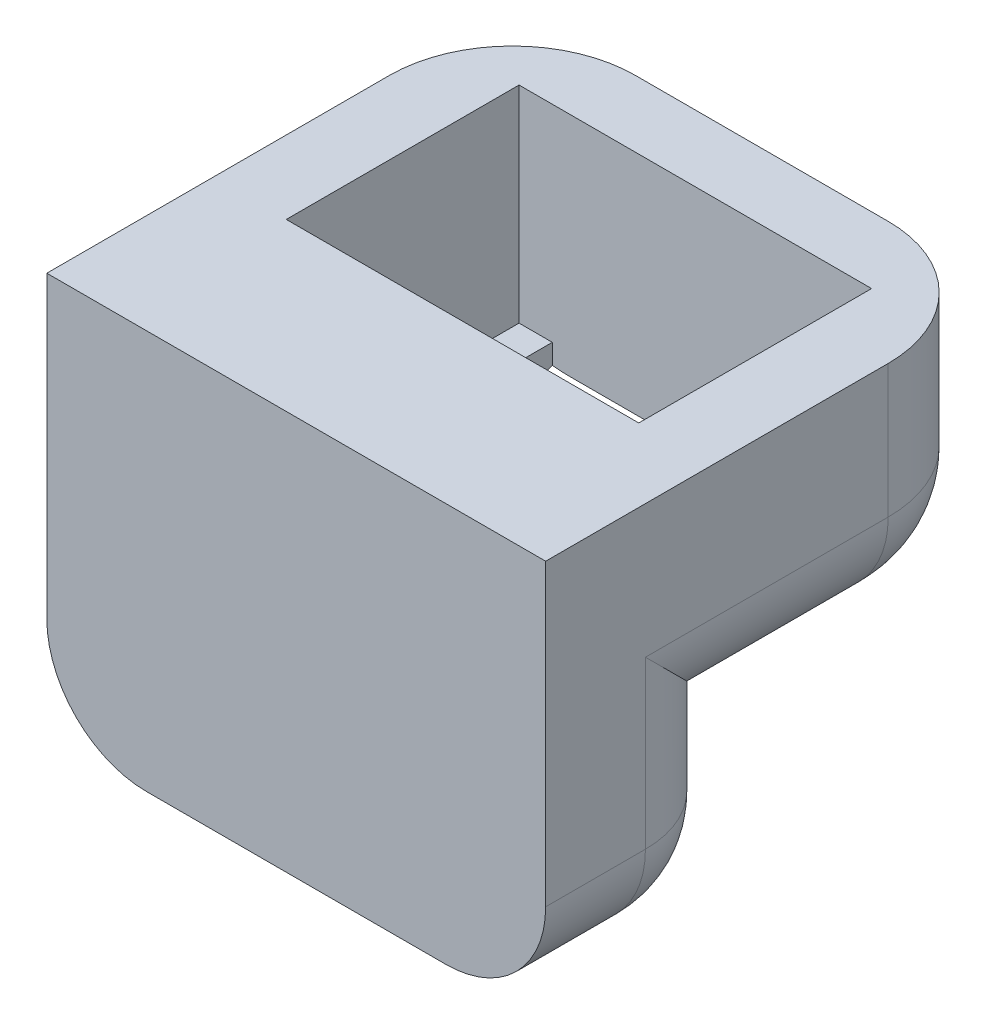
from build123d import *

# Parameters (mm, degrees)
SKETCH1_W           = 15
SKETCH1_H           = 14
BOSS_EXTRUDE1_DEPTH = 7
FILLET1_R           = 3.7
SKETCH2_W           = 10.6
SKETCH2_H           = 7
CUT_EXTRUDE1_DEPTH  = 6.2
SKETCH3_W           = 8.6
SKETCH3_H           = 6
CUT_EXTRUDE2_DEPTH  = 12.987076374
SKETCH4_W           = 15
SKETCH4_H           = 6
BOSS_EXTRUDE2_DEPTH = 5
FILLET8_R           = 3
FILLET9_R           = 3
FILLET10_R          = 3


with BuildPart() as part:
    # Sketch1 → Boss-Extrude1 (new body)
    with BuildSketch(Plane(origin=(0, 0, 0), x_dir=(1, 0, 0), z_dir=(0, 1, 0))):
        Rectangle(SKETCH1_W, SKETCH1_H)
    extrude(amount=BOSS_EXTRUDE1_DEPTH)

    # Fillet1
    fillet1_edges = [part.edges().sort_by_distance(p)[0] for p in [
        (-7.5, 3.5, -7),
        (7.5, 3.5, -7),
    ]]
    fillet(fillet1_edges, radius=FILLET1_R)

    # Sketch2 → Cut-Extrude1 (cut)
    with BuildSketch(Plane(origin=(0, 7, 0), x_dir=(1, 0, 0), z_dir=(0, 1, 0))):
        with Locations((0, 1.5)):
            Rectangle(SKETCH2_W, SKETCH2_H)
    extrude(amount=-CUT_EXTRUDE1_DEPTH, mode=Mode.SUBTRACT)

    # Sketch3 → Cut-Extrude2 (cut, through all)
    with BuildSketch(Plane(origin=(0, 0.8, 0), x_dir=(1, 0, 0), z_dir=(0, 1, 0))):
        with Locations((0, 2)):
            Rectangle(SKETCH3_W, SKETCH3_H)
    extrude(amount=-CUT_EXTRUDE2_DEPTH, mode=Mode.SUBTRACT)

    # Sketch4 → Boss-Extrude2 (add)
    with BuildSketch(Plane.XZ):
        with Locations((0, 4)):
            Rectangle(SKETCH4_W, SKETCH4_H)
    extrude(amount=BOSS_EXTRUDE2_DEPTH)

    # Fillet8
    fillet8_edges = [part.edges().sort_by_distance(p)[0] for p in [
        (-7.5, -5, 4),
        (7.5, -5, 4),
    ]]
    fillet(fillet8_edges, radius=FILLET8_R)

    # Fillet9
    # the kernel refuses this fillet: 3 mm, written as the material it takes off along each edge
    with BuildSketch(Plane(origin=(-3.8, 0, -3.3), x_dir=(0, 0, -1), z_dir=(1, 0, 0))) as fillet9_piece_1:
        with BuildLine():
            CenterArc((3.7 - FILLET9_R, FILLET9_R), FILLET9_R, 270, 90)
            Line((3.7, FILLET9_R), (3.7, 0))
            Line((3.7, 0), (3.7 - FILLET9_R, 0))
        make_face()
    revolve(axis=Axis((-3.8, 0, -3.3), (0, 1, 0)), revolution_arc=90, mode=Mode.SUBTRACT)
    with BuildSketch(Plane(origin=(3.8, 0, -3.3), x_dir=(0, 0, -1), z_dir=(-1, 0, 0))) as fillet9_piece_2:
        with BuildLine():
            CenterArc((3.7 - FILLET9_R, -FILLET9_R), FILLET9_R, 0, 90)
            Line((3.7, -FILLET9_R), (3.7, 0))
            Line((3.7, 0), (3.7 - FILLET9_R, 0))
        make_face()
    revolve(axis=Axis((3.8, 0, -3.3), (0, -1, 0)), revolution_arc=90, mode=Mode.SUBTRACT)
    with BuildSketch(Plane(origin=(-7.5, 0, 1), x_dir=(0, 1, 0), z_dir=(0, 0, -1))) as fillet9_piece_3:
        with BuildLine():
            CenterArc((FILLET9_R, FILLET9_R), FILLET9_R, 180, 90)
            Line((0, FILLET9_R), (0, 0))
            Line((0, 0), (FILLET9_R, 0))
        make_face()
    extrude(amount=4.3, mode=Mode.SUBTRACT)
    with BuildSketch(Plane(origin=(7.5, 0, -3.3), x_dir=(-1, 0, 0), z_dir=(0, 0, 1))) as fillet9_piece_4:
        with BuildLine():
            CenterArc((FILLET9_R, -FILLET9_R), FILLET9_R, 90, 90)
            Line((0, -FILLET9_R), (0, 0))
            Line((0, 0), (FILLET9_R, 0))
        make_face()
    extrude(amount=4.3, mode=Mode.SUBTRACT)
    with BuildSketch(Plane(origin=(-3.8, 0, -7), x_dir=(0, 0, 1), z_dir=(1, 0, 0))) as fillet9_piece_5:
        with BuildLine():
            CenterArc((FILLET9_R, -FILLET9_R), FILLET9_R, 90, 90)
            Line((0, -FILLET9_R), (0, 0))
            Line((0, 0), (FILLET9_R, 0))
        make_face()
    extrude(amount=7.6, mode=Mode.SUBTRACT)

    # Fillet10
    fillet10_edges = [part.edges().sort_by_distance(p)[0] for p in [
        (0, -5, 1),
        (7.5, 0.5, 1),
        (-7.5, 0.5, 1),
        (6.621320344, -4.121320344, 1),
        (-6.621320344, -4.121320344, 1),
    ]]
    fillet(fillet10_edges, radius=FILLET10_R)


solid = part.part
